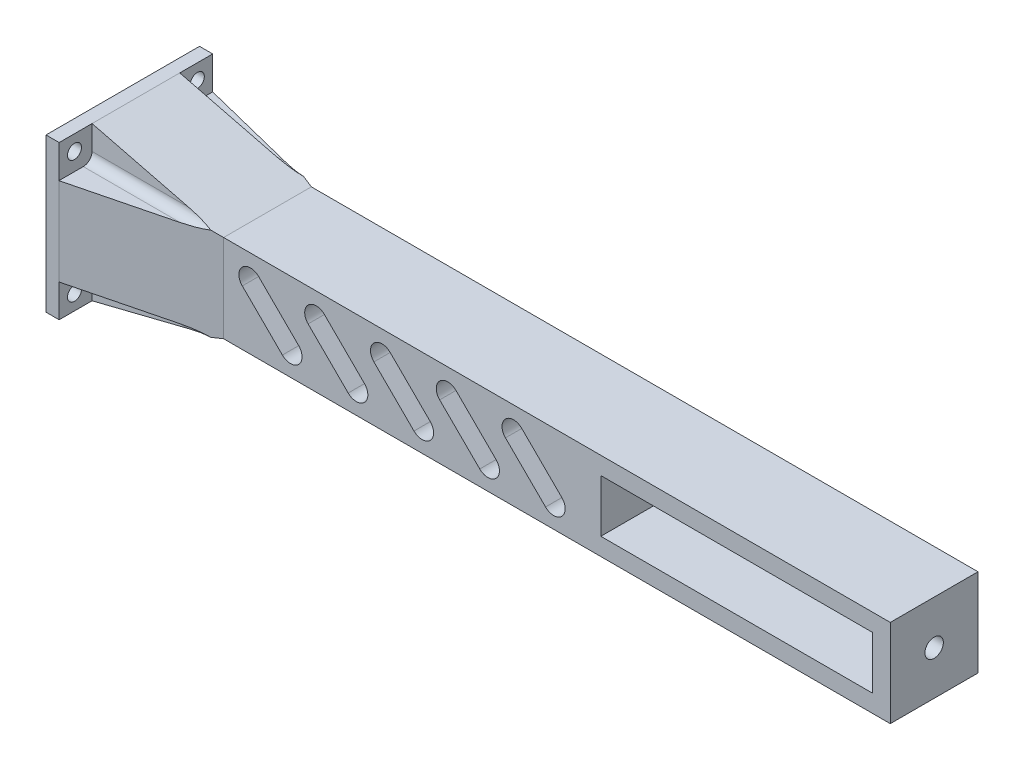
from build123d import *

# Parameters (mm, degrees)
SKETCH_1_W          = 20
SKETCH_1_H          = 20
EXTRUDE_1_DEPTH     = 182
SKETCH_3_W          = 35
SKETCH_3_H          = 35
EXTRUDE_2_DEPTH     = 3
SKETCH_4_R          = 2.1
CUT_EXTRUDE_2_DEPTH = 23
CUT_EXTRUDE_3_REACH = 188.648
SKETCH_5_R          = 1.6
EXTRUDE_3_DEPTH     = 20
EXTRUDE_4_DEPTH     = 20
FILLET_1_R          = 2
CUT_EXTRUDE_4_REACH = 186.903
SKETCH_8_W          = 62
SKETCH_8_H          = 12
CUT_EXTRUDE_6_REACH = 186.896


with BuildPart() as part:
    # 草图1 → 凸台-拉伸1 (new body)
    with BuildSketch(Plane(origin=(0, 0, 0), x_dir=(0, 0, -1), z_dir=(1, 0, 0))):
        Rectangle(SKETCH_1_W, SKETCH_1_H)
    extrude(amount=EXTRUDE_1_DEPTH)

    # 草图3 → 凸台-拉伸2 (add)
    with BuildSketch(Plane.ZY):
        Rectangle(SKETCH_3_W, SKETCH_3_H)
    extrude(amount=EXTRUDE_2_DEPTH)

    # 草图4 → 切除-拉伸2 (cut)
    with BuildSketch(Plane(origin=(182, 0, 0), x_dir=(0, 0, -1), z_dir=(1, 0, 0))):
        Circle(SKETCH_4_R)
    extrude(amount=-CUT_EXTRUDE_2_DEPTH, mode=Mode.SUBTRACT)

    # 草图5 → 切除-拉伸3 (cut, up to next)
    with BuildSketch(Plane.ZY.offset(3), mode=Mode.PRIVATE) as cut_extrude_3_sk1:
        with Locations((-14, 14)):
            Circle(SKETCH_5_R)
    cut_extrude_3_tool1 = extrude(cut_extrude_3_sk1.sketch, amount=-CUT_EXTRUDE_3_REACH, mode=Mode.PRIVATE) & part.part
    # 草图5 → 切除-拉伸3 (cut, up to next)
    with BuildSketch(Plane.ZY.offset(3), mode=Mode.PRIVATE) as cut_extrude_3_sk2:
        with Locations((14, 14)):
            Circle(SKETCH_5_R)
    cut_extrude_3_tool2 = extrude(cut_extrude_3_sk2.sketch, amount=-CUT_EXTRUDE_3_REACH, mode=Mode.PRIVATE) & part.part
    # 草图5 → 切除-拉伸3 (cut, up to next)
    with BuildSketch(Plane.ZY.offset(3), mode=Mode.PRIVATE) as cut_extrude_3_sk3:
        with Locations((-14, -14)):
            Circle(SKETCH_5_R)
    cut_extrude_3_tool3 = extrude(cut_extrude_3_sk3.sketch, amount=-CUT_EXTRUDE_3_REACH, mode=Mode.PRIVATE) & part.part
    # 草图5 → 切除-拉伸3 (cut, up to next)
    with BuildSketch(Plane.ZY.offset(3), mode=Mode.PRIVATE) as cut_extrude_3_sk4:
        with Locations((14, -14)):
            Circle(SKETCH_5_R)
    cut_extrude_3_tool4 = extrude(cut_extrude_3_sk4.sketch, amount=-CUT_EXTRUDE_3_REACH, mode=Mode.PRIVATE) & part.part
    add(cut_extrude_3_tool1.solids().sort_by_distance((-3, 14, -14))[0], mode=Mode.SUBTRACT)
    add(cut_extrude_3_tool2.solids().sort_by_distance((-3, 14, 14))[0], mode=Mode.SUBTRACT)
    add(cut_extrude_3_tool3.solids().sort_by_distance((-3, -14, -14))[0], mode=Mode.SUBTRACT)
    add(cut_extrude_3_tool4.solids().sort_by_distance((-3, -14, 14))[0], mode=Mode.SUBTRACT)

    # 草图6 → 凸台-拉伸3 (add)
    with BuildSketch(Plane(origin=(0, 0, -10), x_dir=(-1, 0, 0), z_dir=(0, 0, -1))):
        Polygon((-30, 10), (0, 17.5), (0, 10), align=None)
        Polygon((0, -10), (-30, -10), (0, -17.5), align=None)
    extrude(amount=-EXTRUDE_3_DEPTH)

    # 草图7 → 凸台-拉伸4 (add)
    with BuildSketch(Plane(origin=(0, 10, 0), x_dir=(1, 0, 0), z_dir=(0, 1, 0))):
        Polygon((0, 10), (30, 10), (0, 17.5), align=None)
        Polygon((30, -10), (0, -10), (0, -17.550639808), align=None)
    extrude(amount=-EXTRUDE_4_DEPTH)

    # 圆角1
    # the kernel refuses this fillet: 2 mm, written as the material it adds along each edge
    with BuildSketch(Plane(origin=(-5, 10, -10), x_dir=(0, 0, -1), z_dir=(1, 0, 0))) as fillet_1_piece_1_section:
        with BuildLine():
            CenterArc((FILLET_1_R, FILLET_1_R), FILLET_1_R, 180, 90)
            Line((0, FILLET_1_R), (0, 0))
            Line((0, 0), (FILLET_1_R, 0))
        make_face()
    fillet_1_piece_1 = extrude(amount=40, mode=Mode.PRIVATE)
    fillet_1_piece_1 = split(fillet_1_piece_1, bisect_by=Plane(origin=(14.470095562, 13.882476109, -10.438694278), z_dir=(-0.24253562503633314, -0.9701425001453319, 0)), keep=Keep.TOP, mode=Mode.PRIVATE)
    fillet_1_piece_1 = split(fillet_1_piece_1, bisect_by=Plane(origin=(-3, 10.438694278, -10.438694278), z_dir=(1, 0, 0)), keep=Keep.TOP, mode=Mode.PRIVATE)
    fillet_1_piece_1 = split(fillet_1_piece_1, bisect_by=Plane(origin=(14.470095562, 10.438694278, -13.882476109), z_dir=(-0.24253562503633308, 0, 0.9701425001453319)), keep=Keep.TOP, mode=Mode.PRIVATE)
    add(fillet_1_piece_1)
    with BuildSketch(Plane(origin=(0, -10, -10), x_dir=(0, -1, 0), z_dir=(1, 0, 0))) as fillet_1_piece_2_section:
        with BuildLine():
            CenterArc((FILLET_1_R, FILLET_1_R), FILLET_1_R, 180, 90)
            Line((0, FILLET_1_R), (0, 0))
            Line((0, 0), (FILLET_1_R, 0))
        make_face()
    fillet_1_piece_2 = extrude(amount=35, mode=Mode.PRIVATE)
    fillet_1_piece_2 = split(fillet_1_piece_2, bisect_by=Plane(origin=(14.470095562, -10.438694278, -13.882476109), z_dir=(-0.24253562503633308, 0, 0.9701425001453319)), keep=Keep.TOP, mode=Mode.PRIVATE)
    fillet_1_piece_2 = split(fillet_1_piece_2, bisect_by=Plane(origin=(14.470095562, -13.882476109, -10.438694278), z_dir=(-0.24253562503633314, 0.9701425001453319, 0)), keep=Keep.TOP, mode=Mode.PRIVATE)
    add(fillet_1_piece_2)
    with BuildSketch(Plane(origin=(35, 10, 10), x_dir=(0, 1, 0), z_dir=(-1, 0, 0))) as fillet_1_piece_3_section:
        with BuildLine():
            CenterArc((FILLET_1_R, -FILLET_1_R), FILLET_1_R, 90, 90)
            Line((0, -FILLET_1_R), (0, 0))
            Line((0, 0), (FILLET_1_R, 0))
        make_face()
    fillet_1_piece_3 = extrude(amount=40, mode=Mode.PRIVATE)
    fillet_1_piece_3 = split(fillet_1_piece_3, bisect_by=Plane(origin=(14.474382617, 13.881404346, 10.438850692), z_dir=(-0.24253562503633314, -0.9701425001453319, 0)), keep=Keep.TOP, mode=Mode.PRIVATE)
    fillet_1_piece_3 = split(fillet_1_piece_3, bisect_by=Plane(origin=(-3, 10.438597443, 10.438850692), z_dir=(1, 0, 0)), keep=Keep.TOP, mode=Mode.PRIVATE)
    fillet_1_piece_3 = split(fillet_1_piece_3, bisect_by=Plane(origin=(14.485990983, 10.438597443, 13.904689802), z_dir=(-0.24407597060240918, 0, -0.969756113966028)), keep=Keep.TOP, mode=Mode.PRIVATE)
    add(fillet_1_piece_3)
    with BuildSketch(Plane(origin=(35, -10, 10), x_dir=(0, 0, 1), z_dir=(-1, 0, 0))) as fillet_1_piece_4_section:
        with BuildLine():
            CenterArc((FILLET_1_R, -FILLET_1_R), FILLET_1_R, 90, 90)
            Line((0, -FILLET_1_R), (0, 0))
            Line((0, 0), (FILLET_1_R, 0))
        make_face()
    fillet_1_piece_4 = extrude(amount=35, mode=Mode.PRIVATE)
    fillet_1_piece_4 = split(fillet_1_piece_4, bisect_by=Plane(origin=(14.474382617, -13.881404346, 10.438850692), z_dir=(-0.24253562503633314, 0.9701425001453319, 0)), keep=Keep.TOP, mode=Mode.PRIVATE)
    fillet_1_piece_4 = split(fillet_1_piece_4, bisect_by=Plane(origin=(14.485990983, -10.438597443, 13.904689802), z_dir=(-0.24407597060240918, 0, -0.969756113966028)), keep=Keep.TOP, mode=Mode.PRIVATE)
    add(fillet_1_piece_4)

    # 草图8 → 切除-拉伸4 (cut, up to next)
    with BuildSketch(Plane(origin=(0, 0, -10), x_dir=(-1, 0, 0), z_dir=(0, 0, -1)), mode=Mode.PRIVATE) as cut_extrude_4_sk1:
        with Locations((-147, 0)):
            Rectangle(SKETCH_8_W, SKETCH_8_H)
    cut_extrude_4_tool1 = extrude(cut_extrude_4_sk1.sketch, amount=-CUT_EXTRUDE_4_REACH, mode=Mode.PRIVATE) & part.part
    add(cut_extrude_4_tool1.solids().sort_by_distance((147, 0, -10))[0], mode=Mode.SUBTRACT)

    # 草图9 → 切除-拉伸6 (cut, up to next)
    with BuildSketch(Plane.XY.offset(10), mode=Mode.PRIVATE) as cut_extrude_6_sk1:
        with BuildLine():
            Line((97.964235065, 6.297490727), (107.103469291, -2.781172596))
            ThreePointArc((107.103469291, -2.781172596), (107.115824812, -6.497340056), (103.399657352, -6.509695577))
            Line((103.399657352, -6.509695577), (94.260423126, 2.568967746))
            ThreePointArc((94.260423126, 2.568967746), (94.248067605, 6.285135206), (97.964235065, 6.297490727))
        make_face()
    cut_extrude_6_tool1 = extrude(cut_extrude_6_sk1.sketch, amount=-CUT_EXTRUDE_6_REACH, mode=Mode.PRIVATE) & part.part
    # 草图9 → 切除-拉伸6 (cut, up to next)
    with BuildSketch(Plane.XY.offset(10), mode=Mode.PRIVATE) as cut_extrude_6_sk2:
        with BuildLine():
            Line((82.964235065, 6.297490727), (92.103469291, -2.781172596))
            ThreePointArc((92.103469291, -2.781172596), (92.115824812, -6.497340056), (88.399657352, -6.509695577))
            Line((88.399657352, -6.509695577), (79.260423126, 2.568967746))
            ThreePointArc((79.260423126, 2.568967746), (79.248067605, 6.285135206), (82.964235065, 6.297490727))
        make_face()
    cut_extrude_6_tool2 = extrude(cut_extrude_6_sk2.sketch, amount=-CUT_EXTRUDE_6_REACH, mode=Mode.PRIVATE) & part.part
    # 草图9 → 切除-拉伸6 (cut, up to next)
    with BuildSketch(Plane.XY.offset(10), mode=Mode.PRIVATE) as cut_extrude_6_sk3:
        with BuildLine():
            Line((67.964235065, 6.297490727), (77.103469291, -2.781172596))
            ThreePointArc((77.103469291, -2.781172596), (77.115824812, -6.497340056), (73.399657352, -6.509695577))
            Line((73.399657352, -6.509695577), (64.260423126, 2.568967746))
            ThreePointArc((64.260423126, 2.568967746), (64.248067605, 6.285135206), (67.964235065, 6.297490727))
        make_face()
    cut_extrude_6_tool3 = extrude(cut_extrude_6_sk3.sketch, amount=-CUT_EXTRUDE_6_REACH, mode=Mode.PRIVATE) & part.part
    # 草图9 → 切除-拉伸6 (cut, up to next)
    with BuildSketch(Plane.XY.offset(10), mode=Mode.PRIVATE) as cut_extrude_6_sk4:
        with BuildLine():
            Line((52.964235065, 6.297490727), (62.103469291, -2.781172596))
            ThreePointArc((62.103469291, -2.781172596), (62.115824812, -6.497340056), (58.399657352, -6.509695577))
            Line((58.399657352, -6.509695577), (49.260423126, 2.568967746))
            ThreePointArc((49.260423126, 2.568967746), (49.248067605, 6.285135206), (52.964235065, 6.297490727))
        make_face()
    cut_extrude_6_tool4 = extrude(cut_extrude_6_sk4.sketch, amount=-CUT_EXTRUDE_6_REACH, mode=Mode.PRIVATE) & part.part
    # 草图9 → 切除-拉伸6 (cut, up to next)
    with BuildSketch(Plane.XY.offset(10), mode=Mode.PRIVATE) as cut_extrude_6_sk5:
        with BuildLine():
            Line((37.964235065, 6.297490727), (47.103469291, -2.781172596))
            ThreePointArc((47.103469291, -2.781172596), (47.115824812, -6.497340056), (43.399657352, -6.509695577))
            Line((43.399657352, -6.509695577), (34.260423126, 2.568967746))
            ThreePointArc((34.260423126, 2.568967746), (34.248067605, 6.285135206), (37.964235065, 6.297490727))
        make_face()
    cut_extrude_6_tool5 = extrude(cut_extrude_6_sk5.sketch, amount=-CUT_EXTRUDE_6_REACH, mode=Mode.PRIVATE) & part.part
    add(cut_extrude_6_tool1.solids().sort_by_distance((100.681946, -0.106102, 10))[0], mode=Mode.SUBTRACT)
    add(cut_extrude_6_tool2.solids().sort_by_distance((85.681946, -0.106102, 10))[0], mode=Mode.SUBTRACT)
    add(cut_extrude_6_tool3.solids().sort_by_distance((70.681946, -0.106102, 10))[0], mode=Mode.SUBTRACT)
    add(cut_extrude_6_tool4.solids().sort_by_distance((55.681946, -0.106102, 10))[0], mode=Mode.SUBTRACT)
    add(cut_extrude_6_tool5.solids().sort_by_distance((40.681946, -0.106102, 10))[0], mode=Mode.SUBTRACT)


solid = part.part
